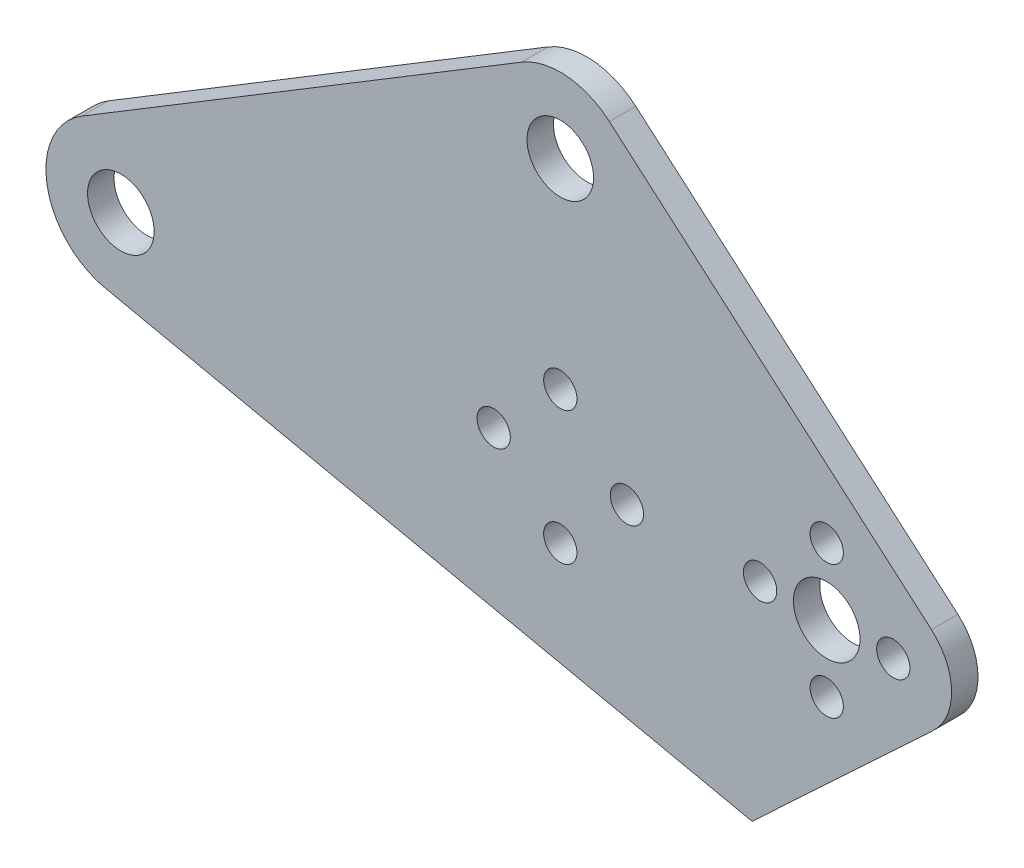
from build123d import *

# Parameters (mm, degrees)
SKETCH1_R           = 4
SKETCH1_R_2         = 2
BOSS_EXTRUDE1_DEPTH = 3.175


with BuildPart() as part:
    # Sketch1 → Boss-Extrude1 (new body)
    with BuildSketch(Plane.XY):
        with BuildLine():
            Line((-4.665710042, 7.69617761), (48.118899649, 39.69617761))
            ThreePointArc((48.118899649, 39.69617761), (53.543313423, 40.967963461), (58.676968473, 38.802948477))
            Line((58.676968473, 38.802948477), (97.36755541, 5.291182149))
            ThreePointArc((97.36755541, 5.291182149), (99.783371388, 0.131661326), (97.563318746, -5.115069869))
            Line((97.563318746, -5.115069869), (75.824988549, -25.423913737))
            Line((75.824988549, -25.423913737), (-1.882663558, -8.800885065))
            ThreePointArc((-1.882663558, -8.800885065), (-8.874602438, -1.497141134), (-4.665710042, 7.69617761))
        make_face()
        Circle(SKETCH1_R, mode=Mode.SUBTRACT)
        with Locations((84.784609691, 0)):
            Circle(SKETCH1_R, mode=Mode.SUBTRACT)
        with Locations((60.784609691, 0)):
            Circle(SKETCH1_R_2, mode=Mode.SUBTRACT)
        with Locations((52.784609691, -8)):
            Circle(SKETCH1_R_2, mode=Mode.SUBTRACT)
        with Locations((44.784609691, 0)):
            Circle(SKETCH1_R_2, mode=Mode.SUBTRACT)
        with Locations((52.784609691, 8)):
            Circle(SKETCH1_R_2, mode=Mode.SUBTRACT)
        with Locations((52.784609691, 32)):
            Circle(SKETCH1_R, mode=Mode.SUBTRACT)
        with Locations((92.784609691, 0)):
            Circle(SKETCH1_R_2, mode=Mode.SUBTRACT)
        with Locations((84.784609691, -8)):
            Circle(SKETCH1_R_2, mode=Mode.SUBTRACT)
        with Locations((76.784609691, 0)):
            Circle(SKETCH1_R_2, mode=Mode.SUBTRACT)
        with Locations((84.784609691, 8)):
            Circle(SKETCH1_R_2, mode=Mode.SUBTRACT)
    extrude(amount=BOSS_EXTRUDE1_DEPTH)


solid = part.part
